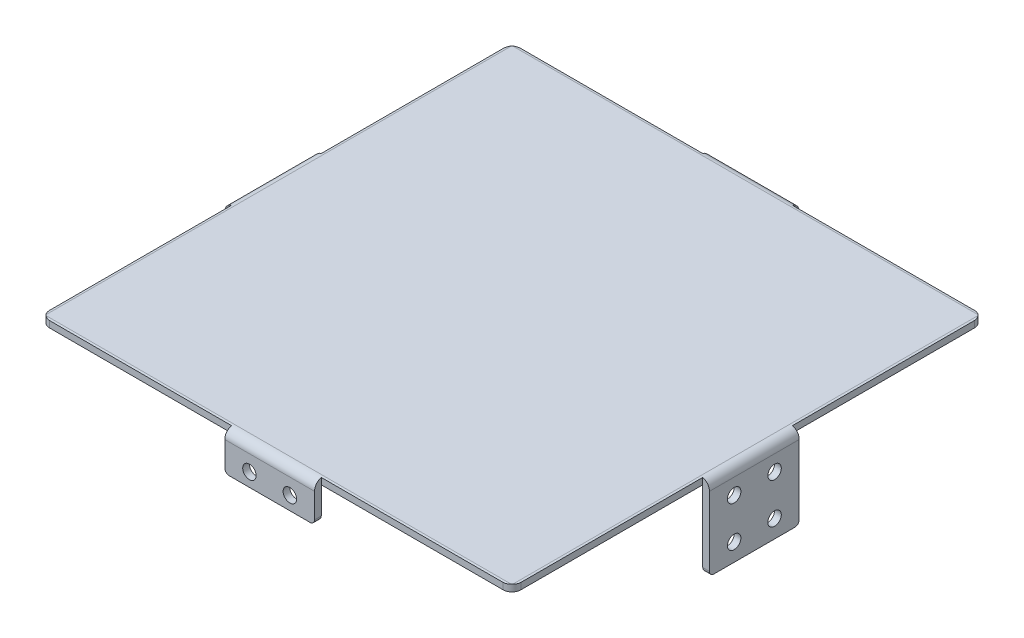
from build123d import *

# Parameters (mm, degrees)
SKETCH1_W           = 105
SKETCH1_H           = 105
BOSS_EXTRUDE1_DEPTH = 1.5
SKETCH2_W           = 20
SKETCH2_H           = 1.5
BOSS_EXTRUDE2_DEPTH = 8.5
SKETCH3_W           = 1.5
SKETCH3_H           = 20
BOSS_EXTRUDE3_DEPTH = 18.45
SKETCH4_R           = 1.5
CUT_EXTRUDE1_DEPTH  = 122.93154842
SKETCH5_R           = 1.5
CUT_EXTRUDE2_DEPTH  = 122.93154842
FILLET1_R           = 1
FILLET2_START       = -53.84589
FILLET2_DEPTH       = 107.69178
FILLET2_START_2     = -53
FILLET2_2_DEPTH     = 106
FILLET3_R           = 2


with BuildPart() as part:
    # Sketch1 → Boss-Extrude1 (new body)
    with BuildSketch(Plane(origin=(0, 0, 0), x_dir=(1, 0, 0), z_dir=(0, 1, 0))):
        Rectangle(SKETCH1_W, SKETCH1_H)
    extrude(amount=BOSS_EXTRUDE1_DEPTH)

    # Sketch2 → Boss-Extrude2 (add)
    with BuildSketch(Plane(origin=(0, 1.5, 0), x_dir=(1, 0, 0), z_dir=(0, 1, 0))):
        with Locations((0, 53.25)):
            Rectangle(SKETCH2_W, SKETCH2_H)
        with Locations((0, -53.25)):
            Rectangle(SKETCH2_W, SKETCH2_H)
    extrude(amount=-BOSS_EXTRUDE2_DEPTH)

    # Sketch3 → Boss-Extrude3 (add)
    with BuildSketch(Plane(origin=(0, 1.5, 0), x_dir=(1, 0, 0), z_dir=(0, 1, 0))):
        with Locations((53.25, 0)):
            Rectangle(SKETCH3_W, SKETCH3_H)
        with Locations((-53.25, 0)):
            Rectangle(SKETCH3_W, SKETCH3_H)
    extrude(amount=-BOSS_EXTRUDE3_DEPTH)

    # Sketch4 → Cut-Extrude1 (cut, through all)
    with BuildSketch(Plane.XY.offset(54)):
        with Locations((-4.5, -4)):
            Circle(SKETCH4_R)
        with Locations(Location((4.5, -4, 0), (0, 0, 180))):
            Circle(SKETCH4_R)
    extrude(amount=-CUT_EXTRUDE1_DEPTH, mode=Mode.SUBTRACT)

    # Sketch5 → Cut-Extrude2 (cut, through all)
    with BuildSketch(Plane(origin=(54, 0, 0), x_dir=(0, 0, -1), z_dir=(1, 0, 0))):
        with Locations((-4.5, -4)):
            Circle(SKETCH5_R)
        with Locations((4.5, -4)):
            Circle(SKETCH5_R)
        with Locations((4.5, -13)):
            Circle(SKETCH5_R)
        with Locations((-4.5, -13)):
            Circle(SKETCH5_R)
    extrude(amount=-CUT_EXTRUDE2_DEPTH, mode=Mode.SUBTRACT)

    # Fillet1
    fillet1_edges = [part.edges().sort_by_distance(p)[0] for p in [
        (-10, -7, -53.25),
        (10, -7, -53.25),
        (-10, -7, 53.25),
        (10, -7, 53.25),
        (53.25, -16.95, -10),
        (53.25, -16.95, 10),
        (-53.25, -16.95, 10),
        (-53.25, -16.95, -10),
    ]]
    fillet(fillet1_edges, radius=FILLET1_R)

    # Fillet2: read off the stored shape, not the designer's step
    # Fillet2 outline → Fillet2 (cut)
    with BuildSketch(Plane.XY.offset(FILLET2_START)):
        with BuildLine():
            ThreePointArc((52, 1.5), (53.414213562, 0.914213562), (54, -0.5))
            Line((54, -0.5), (54, 1.5))
            Line((54, 1.5), (52, 1.5))
        make_face()
        with BuildLine():
            Line((-52, 1.5), (-54, 1.5))
            Line((-54, 1.5), (-54, -0.5))
            ThreePointArc((-54, -0.5), (-53.414213562, 0.914213562), (-52, 1.5))
        make_face()
    extrude(amount=FILLET2_DEPTH, mode=Mode.SUBTRACT)

    # Fillet2 2 outline → Fillet2 2 (cut)
    with BuildSketch(Plane.YZ.offset(FILLET2_START_2)):
        with BuildLine():
            ThreePointArc((1.5, -52), (0.914213562, -53.414213562), (-0.5, -54))
            Line((-0.5, -54), (1.5, -54))
            Line((1.5, -54), (1.5, -52))
        make_face()
        with BuildLine():
            Line((1.5, 52), (1.5, 54))
            Line((1.5, 54), (-0.5, 54))
            ThreePointArc((-0.5, 54), (0.914213562, 53.414213562), (1.5, 52))
        make_face()
    extrude(amount=FILLET2_2_DEPTH, mode=Mode.SUBTRACT)

    # Fillet3
    # the kernel refuses this fillet: 2 mm, written as the material it takes off along each edge
    with BuildSketch(Plane(origin=(52.5, -5, -52.5), x_dir=(0, 0, 1), z_dir=(0, 1, 0)), Plane(origin=(52.5, -5, 52.5), x_dir=(-1, 0, 0), z_dir=(0, 1, 0)), Plane(origin=(-52.5, -5, -52.5), x_dir=(1, 0, 0), z_dir=(0, 1, 0))) as fillet3_piece_1:
        with BuildLine():
            CenterArc((FILLET3_R, -FILLET3_R), FILLET3_R, 90, 90)
            Line((0, -FILLET3_R), (0, 0))
            Line((0, 0), (FILLET3_R, 0))
        make_face()
    extrude(amount=11.436491673, mode=Mode.SUBTRACT)
    with BuildSketch(Plane(origin=(-52.5, -5, 52.5), x_dir=(1, 0, 0), z_dir=(0, 1, 0))) as fillet3_piece_2:
        with BuildLine():
            CenterArc((FILLET3_R, FILLET3_R), FILLET3_R, 180, 90)
            Line((0, FILLET3_R), (0, 0))
            Line((0, 0), (FILLET3_R, 0))
        make_face()
    extrude(amount=11.436491673, mode=Mode.SUBTRACT)


solid = part.part
